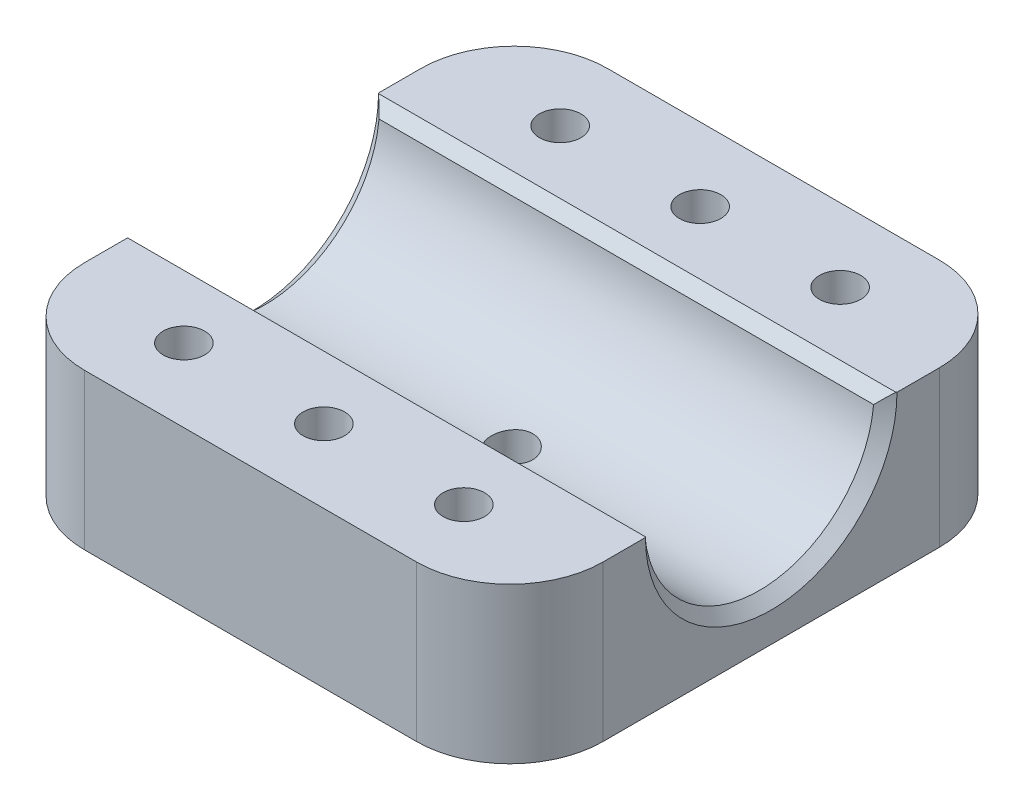
from build123d import *

# Parameters (mm, degrees)
BOSS_EXTRUDE1_DEPTH = 50
SKETCH2_R           = 2
CUT_EXTRUDE1_DEPTH  = 73.582262985
CHAMFER2_START      = -1
CHAMFER2_2_DEPTH    = 52
FILLET3_R           = 9


with BuildPart() as part:
    # Sketch1 → Boss-Extrude1 (new body)
    with BuildSketch(Plane(origin=(0, 0, 0), x_dir=(0, 0, -1), z_dir=(1, 0, 0))):
        with BuildLine():
            Line((14.14, 0), (0, 0))
            Line((0, 0), (0, -15))
            Line((0, -15), (50.43, -15))
            Line((50.43, -15), (50.43, 0))
            Line((50.43, 0), (36.29, 0))
            ThreePointArc((36.29, 0), (25.215, -11.075), (14.14, 0))
        make_face()
    extrude(amount=BOSS_EXTRUDE1_DEPTH)

    # Sketch2 → Cut-Extrude1 (cut, through all)
    with BuildSketch(Plane(origin=(0, 0, 0), x_dir=(1, 0, 0), z_dir=(0, 1, 0))):
        with Locations(Location((11.5, 43.36, 0), (0, 0, 270))):
            Circle(SKETCH2_R)
        with Locations(Location((38.5, 43.36, 0), (0, 0, 90))):
            Circle(SKETCH2_R)
        with Locations(Location((38.5, 7.07, 0), (0, 0, 270))):
            Circle(SKETCH2_R)
        with Locations(Location((11.5, 7.07, 0), (0, 0, 90))):
            Circle(SKETCH2_R)
        with Locations(Location((25, 25.215, 0), (0, 0, 270))):
            Circle(SKETCH2_R)
        with Locations(Location((25, 43.36, 0), (0, 0, 270))):
            Circle(SKETCH2_R)
        with Locations(Location((25, 7.07, 0), (0, 0, 270))):
            Circle(SKETCH2_R)
    extrude(amount=-CUT_EXTRUDE1_DEPTH, mode=Mode.SUBTRACT)

    # Chamfer2: read off the stored shape, not the designer's step
    # Chamfer2 outline → Chamfer2 (revolve, cut)
    with BuildSketch(Plane.YX.offset(25.215)):
        Polygon((12.129624038, 0), (11.075, 1.149849684), (11.075, 0), align=None)
        Polygon((11.075, 50), (11.075, 48.850150316), (12.129624038, 50), align=None)
    revolve(axis=Axis((0, 0, -25.215), (1, 0, 0)), mode=Mode.SUBTRACT)

    # Chamfer2 2 outline → Chamfer2 2 (cut)
    with BuildSketch(Plane.YZ.offset(CHAMFER2_START)):
        with BuildLine():
            Line((0, -14.14), (0, -13.14))
            Line((0, -13.14), (-1.049874688, -14.189874688))
            ThreePointArc((-1.049874688, -14.189874688), (-0.525529339, -14.152475699), (0, -14.14))
        make_face()
        with BuildLine():
            ThreePointArc((0, -36.29), (-0.525529339, -36.277524301), (-1.049874688, -36.240125312))
            Line((-1.049874688, -36.240125312), (0, -37.29))
            Line((0, -37.29), (0, -36.29))
        make_face()
    extrude(amount=CHAMFER2_2_DEPTH, mode=Mode.SUBTRACT)

    # Fillet3
    fillet3_edges = [part.edges().sort_by_distance(p)[0] for p in [
        (50, -7.5, 0),
        (50, -7.5, -50.43),
        (0, -7.5, -50.43),
        (0, -7.5, 0),
    ]]
    fillet(fillet3_edges, radius=FILLET3_R)


solid = part.part
